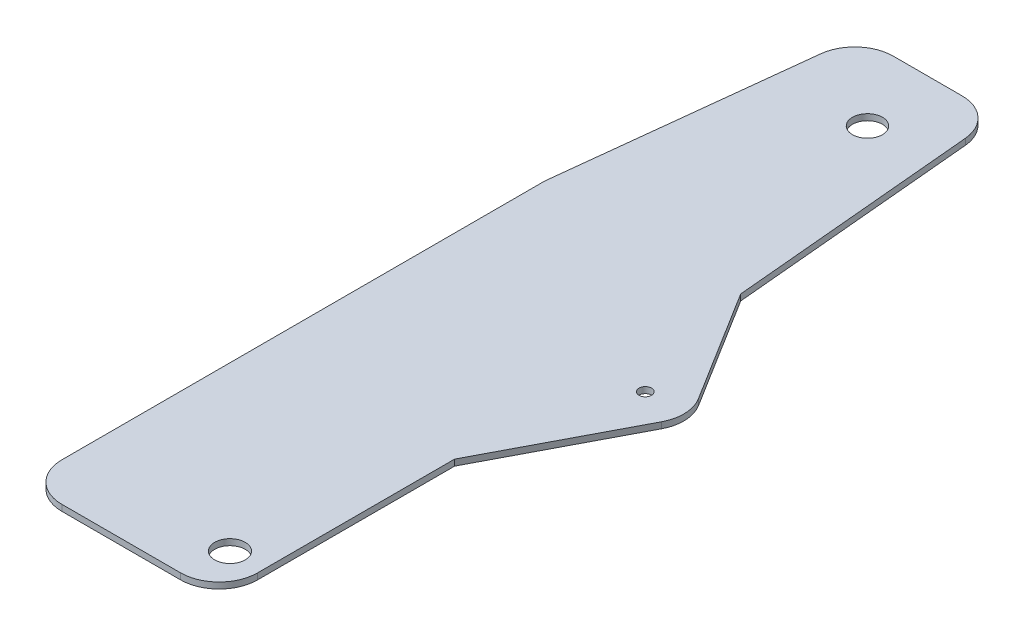
from build123d import *

# Parameters (mm, degrees)
SKETCH1_R           = 5.969
SKETCH1_R_2         = 3.960069723
SKETCH1_R_3         = 3.904180301
BOSS_EXTRUDE1_DEPTH = 1.5875
SKETCH4_W           = 66.272407177
SKETCH4_H           = 27.800260981
CUT_EXTRUDE2_DEPTH  = 20
SKETCH5_R           = 6.683690244
BOSS_EXTRUDE2_DEPTH = 1.5875
FILLET3_R           = 10
FILLET4_R           = 10
BOSS_EXTRUDE3_START = -1.5875
BOSS_EXTRUDE3_DEPTH = 1.5875
SKETCH7_R           = 1.62705579
CUT_EXTRUDE3_DEPTH  = 1.5875


with BuildPart() as part:
    # Sketch1 → Boss-Extrude1 (new body)
    with BuildSketch(Plane(origin=(0, 0, 0), x_dir=(1, 0, 0), z_dir=(0, 1, 0))):
        with BuildLine():
            Line((42.32729629, 228.6), (10.454309325, 228.6))
            Line((10.454309325, 228.6), (0, 135.362739137))
            Line((0, 135.362739137), (0, 0))
            Line((0, 0), (24.327009544, 0))
            Line((24.327009544, 0), (50.8, 0))
            Line((50.8, 0), (50.8, 64.87909603))
            Line((50.8, 64.87909603), (50.8, 87.423477361))
            Line((50.8, 87.423477361), (50.8, 98.200996728))
            ThreePointArc((50.8, 98.200996728), (50.4, 101.000996728), (50.8, 103.800996728))
            Line((50.8, 103.800996728), (50.8, 104.488200565))
            Line((50.8, 104.488200565), (50.8, 120.619222808))
            Line((50.8, 120.619222808), (50.8, 135.362739137))
            Line((50.8, 135.362739137), (42.32729629, 228.6))
        make_face()
        with Locations((24.327009544, 25.509186042)):
            Circle(SKETCH1_R, mode=Mode.SUBTRACT)
        with Locations((42.32729629, 11.29561028)):
            Circle(SKETCH1_R_2, mode=Mode.SUBTRACT)
        with Locations((29.504213454, 189.557234372)):
            Circle(SKETCH1_R_3, mode=Mode.SUBTRACT)
    extrude(amount=BOSS_EXTRUDE1_DEPTH)

    # Sketch4 → Cut-Extrude2 (cut)
    with BuildSketch(Plane(origin=(0, 0, -228.6), x_dir=(-1, 0, 0), z_dir=(0, 0, -1))):
        with Locations((-28.174690156, -1.980940155)):
            Rectangle(SKETCH4_W, SKETCH4_H)
    extrude(amount=-CUT_EXTRUDE2_DEPTH, mode=Mode.SUBTRACT)

    # Sketch5 → Boss-Extrude2 (add)
    with BuildSketch(Plane.XZ):
        with Locations((24.327009544, -25.509186042)):
            Circle(SKETCH5_R)
    extrude(amount=-BOSS_EXTRUDE2_DEPTH)

    # Fillet3
    fillet3_edges = [part.edges().sort_by_distance(p)[0] for p in [
        (44.144746445, 0.79375, -208.6),
    ]]
    fillet(fillet3_edges, radius=FILLET3_R)

    # Fillet4
    fillet4_edges = [part.edges().sort_by_distance(p)[0] for p in [
        (50.8, 0.79375, 0),
        (0, 0.79375, 0),
        (8.211791854, 0.79375, -208.6),
    ]]
    fillet(fillet4_edges, radius=FILLET4_R)

    # Sketch6 → Boss-Extrude3 (add)
    with BuildSketch(Plane(origin=(0, 1.5875, 0), x_dir=(1, 0, 0), z_dir=(0, 1, 0)).offset(BOSS_EXTRUDE3_START)):
        with BuildLine():
            Line((50.8, 135.362739137), (50.8, 103.800996728))
            ThreePointArc((50.8, 103.800996728), (50.4, 101.000996728), (50.8, 98.200996728))
            Line((50.8, 98.200996728), (50.8, 61.124243317))
            Line((50.8, 61.124243317), (69.258211507, 96.360728536))
            ThreePointArc((69.258211507, 96.360728536), (70.393157133, 101.370875786), (68.890940865, 106.283413148))
            Line((68.890940865, 106.283413148), (50.8, 135.362739137))
        make_face()
    extrude(amount=BOSS_EXTRUDE3_DEPTH)

    # Sketch7 → Cut-Extrude3 (cut)
    with BuildSketch(Plane(origin=(0, 1.5875, 0), x_dir=(1, 0, 0), z_dir=(0, 1, 0))):
        with Locations((60.4, 101.000996728)):
            Circle(SKETCH7_R)
    extrude(amount=-CUT_EXTRUDE3_DEPTH, mode=Mode.SUBTRACT)


solid = part.part
